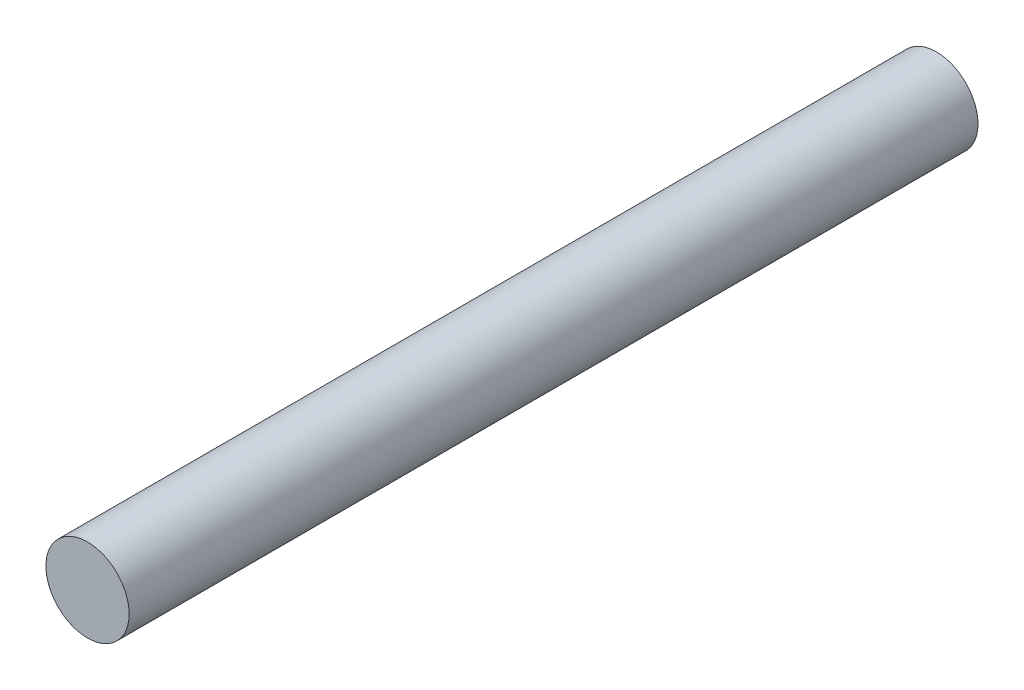
from build123d import *

# Parameters (mm, degrees)
SKETCH1_W = 51
SKETCH1_H = 2.5


with BuildPart() as part:
    # Sketch1 → Revolve1 (revolve)
    with BuildSketch(Plane(origin=(0, 0, 0), x_dir=(0, 0, -1), z_dir=(1, 0, 0))):
        with Locations((0, 1.25)):
            Rectangle(SKETCH1_W, SKETCH1_H)
    revolve(axis=Axis((0, 0, 25.5), (0, 0, -1)))


solid = part.part
